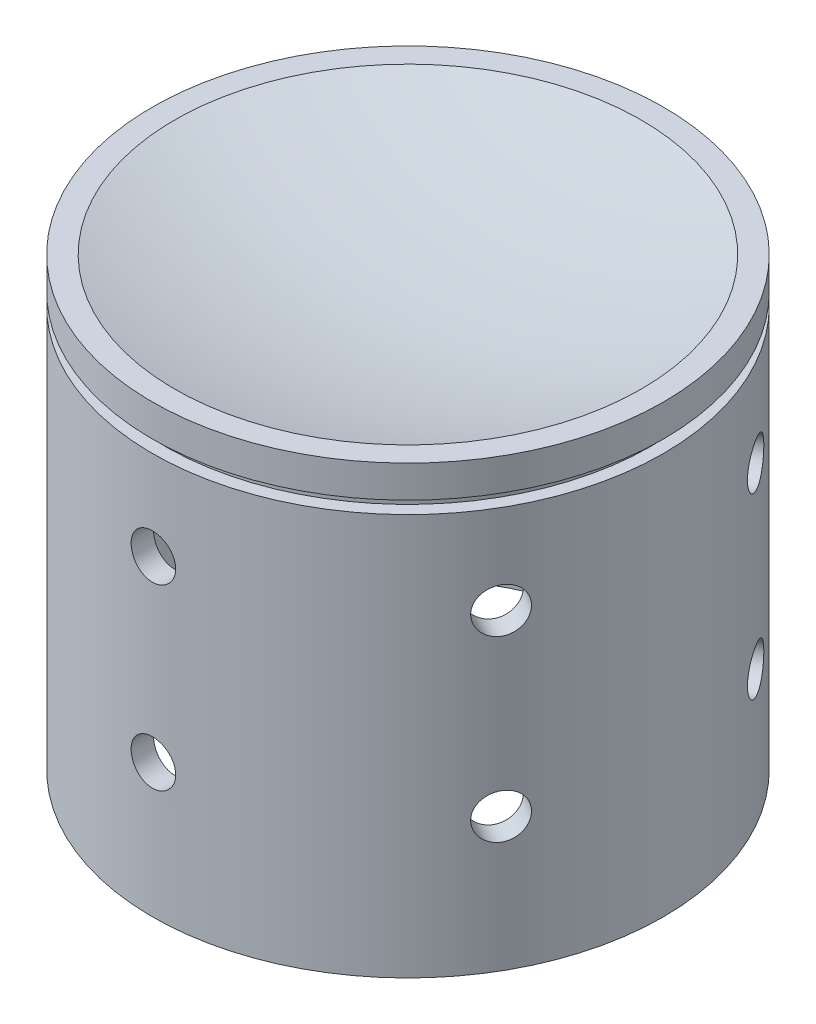
from build123d import *

# Parameters (mm, degrees)
F_1_4_0_25_DIAMETER_HOLE4_D = 6.35
CIRPATTERN2_COUNT           = 6


with BuildPart() as part:
    # Sketch1 → Revolve2 (revolve)
    with BuildSketch(Plane.XY):
        with BuildLine():
            Line((33.2105, -10.16), (33.2105, -63.5))
            Line((33.2105, -63.5), (36.3855, -63.5))
            Line((36.3855, -63.5), (36.3855, -6.35))
            Line((36.3855, -6.35), (34.6075, -6.35))
            Line((34.6075, -6.35), (34.6075, -4.572))
            Line((34.6075, -4.572), (36.3855, -4.572))
            Line((36.3855, -4.572), (36.3855, 0))
            Line((36.3855, 0), (33.2105, 0))
            ThreePointArc((33.2105, 0), (16.798390624, -3.802656831), (0, -5.08))
            Line((0, -5.08), (0, -10.16))
            Line((0, -10.16), (33.2105, -10.16))
        make_face()
    revolve(axis=Axis((0, 0, 0), (0, -1, 0)))

    # 1/4 (0.25) Diameter Hole4 (through all)
    with Locations(Plane(origin=(0, -19.049997805, 36.3855), x_dir=(1, 0, 0), z_dir=(0, 0, 1))):
        with Locations((0, 0), (0, -25.400002195)):
            f_1_4_0_25_diameter_hole4 = Hole(F_1_4_0_25_DIAMETER_HOLE4_D / 2)

    # CirPattern2: 1/4 (0.25) Diameter Hole4 ×6 about axis
    cirpattern2_axis = Axis((0, 0, 0), (0, -1, 0))
    for i in range(1, CIRPATTERN2_COUNT):
        add(f_1_4_0_25_diameter_hole4.rotate(cirpattern2_axis, i * 360 / CIRPATTERN2_COUNT), mode=Mode.SUBTRACT)


solid = part.part
